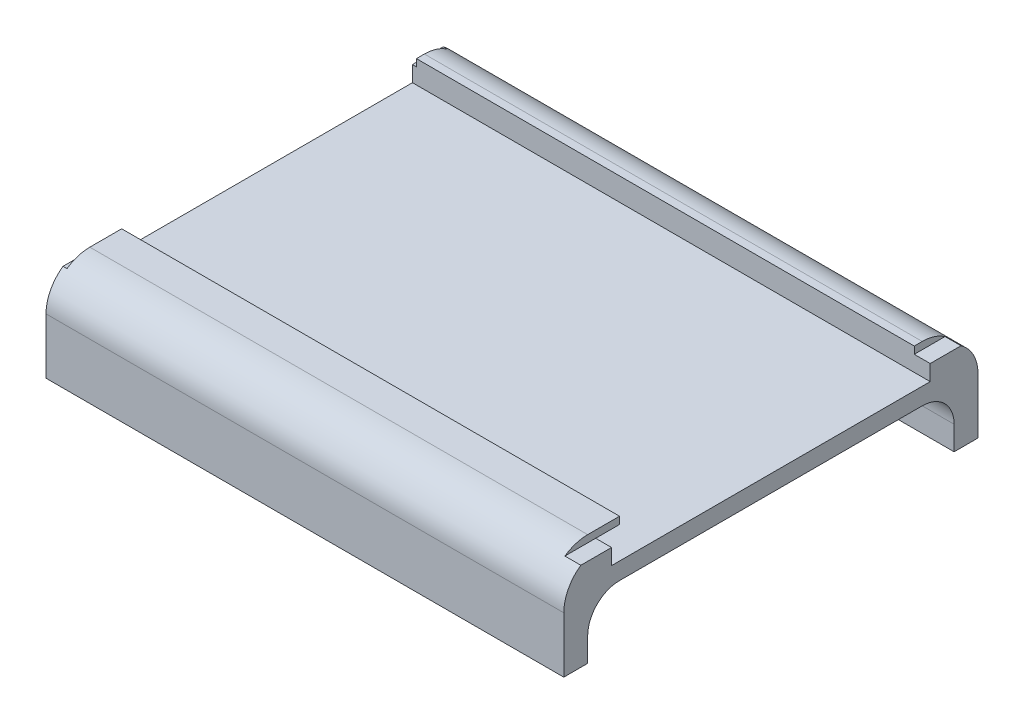
from build123d import *

# Parameters (mm, degrees)
SKETCH1_W           = 165.1
SKETCH1_H           = 132.08
BOSS_EXTRUDE1_DEPTH = 12.7
SKETCH2_W           = 165.1
SKETCH2_H           = 101.6
CUT_EXTRUDE1_DEPTH  = 7.28599
SKETCH3_W           = 1.27
SKETCH3_H           = 15.24
SKETCH3_W_2         = 5.08
CUT_EXTRUDE2_DEPTH  = 2.286
SKETCH5_W           = 165.1
SKETCH5_H           = 7.62
BOSS_EXTRUDE3_DEPTH = 17.78
FILLET1_R           = 12.7
FILLET2_R           = 10.16
SKETCH6_W           = 158.75
SKETCH6_H           = 2.286
BOSS_EXTRUDE5_DEPTH = 7.62


with BuildPart() as part:
    # Sketch1 → Boss-Extrude1 (new body)
    with BuildSketch(Plane(origin=(0, 0, 0), x_dir=(1, 0, 0), z_dir=(0, 1, 0))):
        with Locations((82.55, 66.04)):
            Rectangle(SKETCH1_W, SKETCH1_H)
    extrude(amount=BOSS_EXTRUDE1_DEPTH)

    # Sketch2 → Cut-Extrude1 (cut)
    with BuildSketch(Plane(origin=(0, 12.7, 0), x_dir=(1, 0, 0), z_dir=(0, 1, 0))):
        with Locations((82.55, 66.04)):
            Rectangle(SKETCH2_W, SKETCH2_H)
    extrude(amount=-CUT_EXTRUDE1_DEPTH, mode=Mode.SUBTRACT)

    # Sketch3 → Cut-Extrude2 (cut)
    with BuildSketch(Plane(origin=(0, 12.7, 0), x_dir=(1, 0, 0), z_dir=(0, 1, 0))):
        with Locations((0.635, 124.46)):
            Rectangle(SKETCH3_W, SKETCH3_H)
        with Locations((162.56, 124.46)):
            Rectangle(SKETCH3_W_2, SKETCH3_H)
        with Locations((162.56, 7.62)):
            Rectangle(SKETCH3_W_2, SKETCH3_H)
        with Locations((0.635, 7.62)):
            Rectangle(SKETCH3_W, SKETCH3_H)
    extrude(amount=-CUT_EXTRUDE2_DEPTH, mode=Mode.SUBTRACT)

    # Sketch5 → Boss-Extrude3 (add)
    with BuildSketch(Plane.XZ):
        with Locations((82.55, -128.27)):
            Rectangle(SKETCH5_W, SKETCH5_H)
        with Locations((82.55, -3.81)):
            Rectangle(SKETCH5_W, SKETCH5_H)
    extrude(amount=BOSS_EXTRUDE3_DEPTH)

    # Fillet1
    fillet1_edges = [part.edges().sort_by_distance(p)[0] for p in [
        (80.645, 12.7, 0),
        (80.645, 12.7, -132.08),
    ]]
    fillet(fillet1_edges, radius=FILLET1_R)

    # Fillet2
    fillet2_edges = [part.edges().sort_by_distance(p)[0] for p in [
        (82.55, 0, -7.62),
        (82.55, 0, -124.46),
    ]]
    fillet(fillet2_edges, radius=FILLET2_R)

    # Sketch6 → Boss-Extrude5 (add)
    with BuildSketch(Plane(origin=(0, 0, -15.24), x_dir=(-1, 0, 0), z_dir=(0, 0, -1))):
        with Locations((-80.645, 11.557)):
            Rectangle(SKETCH6_W, SKETCH6_H)
    extrude(amount=BOSS_EXTRUDE5_DEPTH)


solid = part.part
